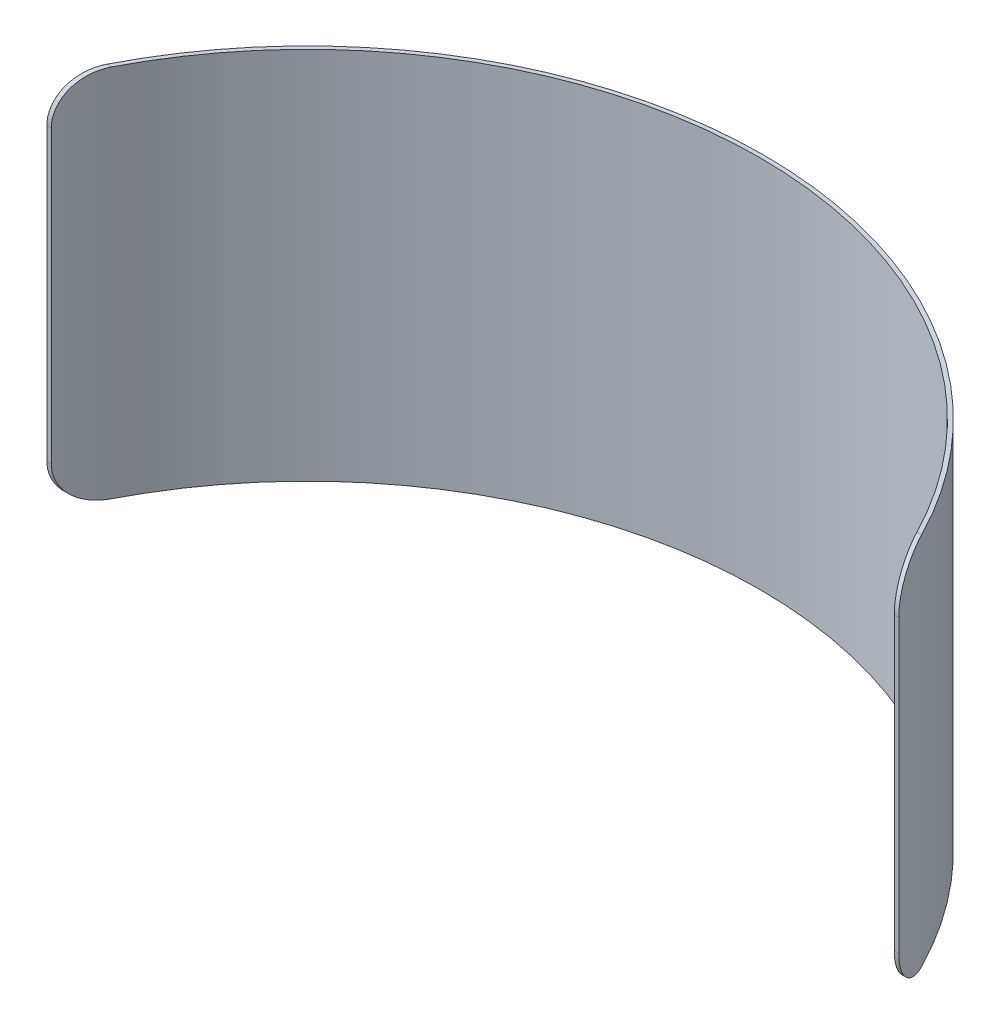
from build123d import *

# Parameters (mm, degrees)
BOSS_EXTRUDE1_DEPTH = 900
FILLET1_START       = -1
FILLET1_DEPTH       = 2052


with BuildPart() as part:
    # Sketch1 → Boss-Extrude1 (new body)
    with BuildSketch(Plane(origin=(0, 0, 0), x_dir=(1, 0, 0), z_dir=(0, 1, 0))):
        with BuildLine():
            Line((0, 0), (10.739185416, 0))
            ThreePointArc((10.739185416, 0), (1025, 690.782014433), (2039.260814584, 0))
            Line((2039.260814584, 0), (2050, 0))
            ThreePointArc((2050, 0), (1025, 700.782014433), (0, 0))
        make_face()
    extrude(amount=BOSS_EXTRUDE1_DEPTH)

    # Fillet1: read off the stored shape, not the designer's step
    # Fillet1 outline → Fillet1 (cut)
    with BuildSketch(Plane.YZ.offset(FILLET1_START)):
        with BuildLine():
            ThreePointArc((0, -100), (29.289321881, -29.289321881), (100, 0))
            Line((100, 0), (0, 0))
            Line((0, 0), (0, -100))
        make_face()
        with BuildLine():
            ThreePointArc((800, 0), (870.710678119, -29.289321881), (900, -100))
            Line((900, -100), (900, 0))
            Line((900, 0), (800, 0))
        make_face()
    extrude(amount=FILLET1_DEPTH, mode=Mode.SUBTRACT)


solid = part.part
